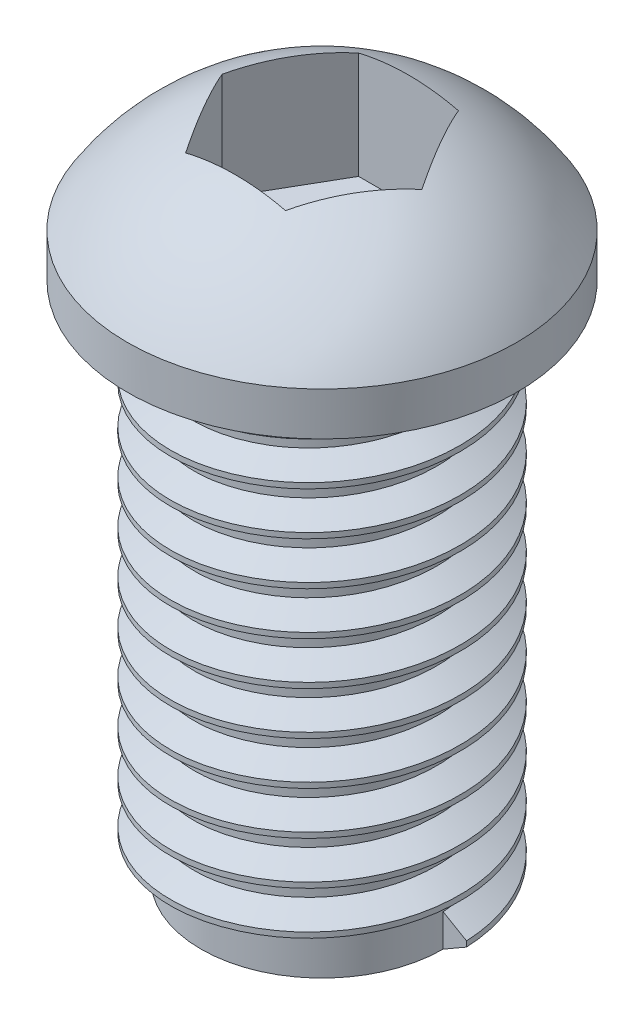
from build123d import *

# Parameters (mm, degrees)
SKETCH1_R           = 1.4
BOSS_EXTRUDE1_DEPTH = 6
CUT_EXTRUDE1_START  = 1.75
CUT_EXTRUDE1_DEPTH  = 1.5
THREAD2_PITCH       = 0.5


with BuildPart() as part:
    # Sketch1 → Boss-Extrude1 (new body)
    with BuildSketch(Plane(origin=(0, 0, 0), x_dir=(1, 0, 0), z_dir=(0, 1, 0))):
        with Locations(Location((0, 0, 0), (0, 0, 270))):
            Circle(SKETCH1_R)
    extrude(amount=-BOSS_EXTRUDE1_DEPTH)

    # Sketch2 → Revolve1 (revolve)
    with BuildSketch(Plane.XY):
        with BuildLine():
            Line((0, 0), (2.25, 0))
            Line((2.25, 0), (2.25, 0.5))
            ThreePointArc((2.25, 0.5), (1.286953768, 1.416516782), (0, 1.75))
            Line((0, 1.75), (0, 0))
        make_face()
    revolve(axis=Axis((0, 0, 0), (0, 1, 0)))

    # Sketch3 → Cut-Extrude1 (cut)
    with BuildSketch(Plane(origin=(0, 0, 0), x_dir=(1, 0, 0), z_dir=(0, 1, 0)).offset(CUT_EXTRUDE1_START)):
        Polygon((1.154700538, 0), (0.577350269, 1), (-0.577350269, 1), (-1.154700538, 0), (-0.577350269, -1), (0.577350269, -1), align=None)
    extrude(amount=-CUT_EXTRUDE1_DEPTH, mode=Mode.SUBTRACT)

    # Thread2: the profile of Thread Profile2 profile screwed along a right-hand helix of 12 turns, 6 arcs to a turn; built about Z, then put on its axis
    thread2_z = Axis((0, 0, 0), (0, 0, 1))
    thread2_corners = [(1.3997, 0, -0.000173205), (1.670632937, 0, 0.156249999), (1.670632937, 0, 0.218749999), (1.3997, 0, 0.375173204)]
    with BuildLine(mode=Mode.PRIVATE) as thread2_profile:
        Line(thread2_corners[0], thread2_corners[1])
        Line(thread2_corners[1], thread2_corners[2])
        Line(thread2_corners[2], thread2_corners[3])
        Line(thread2_corners[3], thread2_corners[0])
    thread2_cap = Face(thread2_profile.wire())
    thread2_turn_angles = [0, 30, 60, 90, 120, 150, 180, 210, 240, 270, 300, 330, 360]
    thread2_turn_weights = [1, 0.8660254037844387, 1, 0.8660254037844387, 1, 0.8660254037844387, 1, 0.8660254037844387, 1, 0.8660254037844387, 1, 0.8660254037844387, 1]
    thread2_turn_rails = [Edge.make_bspline([Vector(p[0], p[1], 0).rotate(thread2_z, thread2_turn_angles[k]) / thread2_turn_weights[k] + Vector(0, 0, p[2] + THREAD2_PITCH * thread2_turn_angles[k] / 360) for k in range(13)], [0, 0, 0, 1, 1, 2, 2, 3, 3, 4, 4, 5, 5, 6, 6, 6], 2, thread2_turn_weights) for p in thread2_corners]
    thread2_turn_sides = [Face.make_surface_from_curves(thread2_turn_rails[p[0]], thread2_turn_rails[p[1]]) for p in [(0, 1), (1, 2), (2, 3), (3, 0)]]
    thread2 = Plane(origin=(0, -6, 0), x_dir=(1, 0, 0), z_dir=(0, 1, 0)) * Solid(Shell([*[p.moved(Location((0, 0, THREAD2_PITCH * i))) for i in range(12) for p in thread2_turn_sides], thread2_cap, thread2_cap.rotate(thread2_z, 4320).moved(Location((0, 0, THREAD2_PITCH * 4320 / 360)))]))
    add(thread2)


solid = part.part
